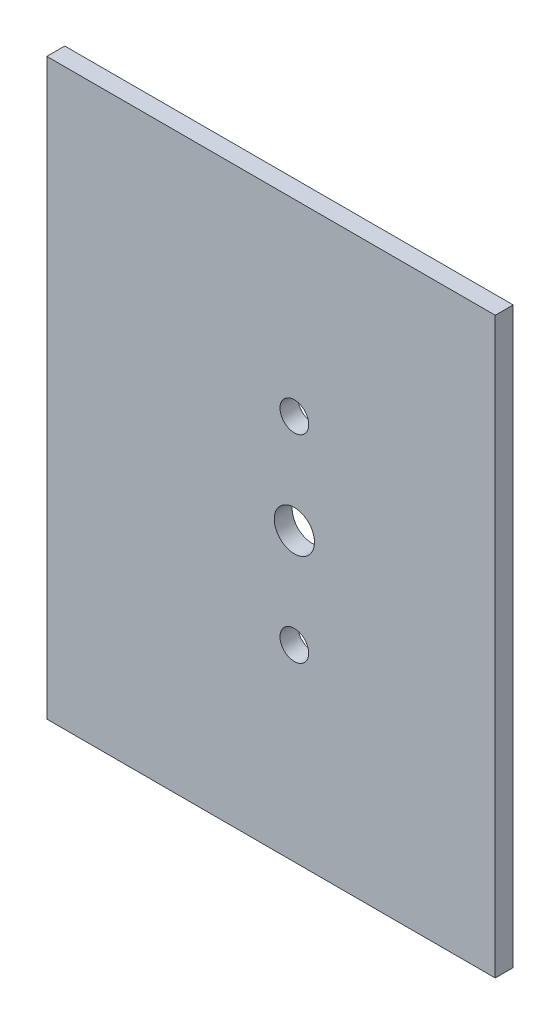
from build123d import *

# Parameters (mm, degrees)
SKETCH2_W           = 22.86
SKETCH2_H           = 50.8
BOSS_EXTRUDE1_DEPTH = 1.5875
SKETCH3_W           = 1.5875
SKETCH3_H           = 50.8
BOSS_EXTRUDE2_DEPTH = 38.1
CUT_EXTRUDE1_REACH  = 54.372
SKETCH4_R           = 1.778
SKETCH4_R_2         = 1.27


with BuildPart() as part:
    # Sketch2 → Boss-Extrude1 (new body)
    with BuildSketch(Plane(origin=(0, 0, 0), x_dir=(0, 0, -1), z_dir=(1, 0, 0))):
        Rectangle(SKETCH2_W, SKETCH2_H)
    extrude(amount=BOSS_EXTRUDE1_DEPTH)

    # Sketch3 → Boss-Extrude2 (add)
    with BuildSketch(Plane(origin=(1.5875, 0, 0), x_dir=(0, 0, -1), z_dir=(1, 0, 0))):
        with Locations((-10.63625, 0)):
            Rectangle(SKETCH3_W, SKETCH3_H)
    extrude(amount=BOSS_EXTRUDE2_DEPTH)

    # Sketch4 → Cut-Extrude1 (cut, up to next)
    with BuildSketch(Plane.XY.offset(11.43), mode=Mode.PRIVATE) as cut_extrude1_sk1:
        with Locations((21.9075, 0)):
            Circle(SKETCH4_R)
    cut_extrude1_tool1 = extrude(cut_extrude1_sk1.sketch, amount=-CUT_EXTRUDE1_REACH, mode=Mode.PRIVATE) & part.part
    # Sketch4 → Cut-Extrude1 (cut, up to next)
    with BuildSketch(Plane.XY.offset(11.43), mode=Mode.PRIVATE) as cut_extrude1_sk2:
        with Locations((21.9075, 8.763)):
            Circle(SKETCH4_R_2)
    cut_extrude1_tool2 = extrude(cut_extrude1_sk2.sketch, amount=-CUT_EXTRUDE1_REACH, mode=Mode.PRIVATE) & part.part
    # Sketch4 → Cut-Extrude1 (cut, up to next)
    with BuildSketch(Plane.XY.offset(11.43), mode=Mode.PRIVATE) as cut_extrude1_sk3:
        with Locations((21.9075, -8.763)):
            Circle(SKETCH4_R_2)
    cut_extrude1_tool3 = extrude(cut_extrude1_sk3.sketch, amount=-CUT_EXTRUDE1_REACH, mode=Mode.PRIVATE) & part.part
    add(cut_extrude1_tool1.solids().sort_by_distance((21.9075, 0, 11.43))[0], mode=Mode.SUBTRACT)
    add(cut_extrude1_tool2.solids().sort_by_distance((21.9075, 8.763, 11.43))[0], mode=Mode.SUBTRACT)
    add(cut_extrude1_tool3.solids().sort_by_distance((21.9075, -8.763, 11.43))[0], mode=Mode.SUBTRACT)

    # Split1
    split(bisect_by=Plane(origin=(39.6875, -25.4, 9.8425), x_dir=(1, 0, 0), z_dir=(0, 0, 1)), keep=Keep.TOP)


solid = part.part
